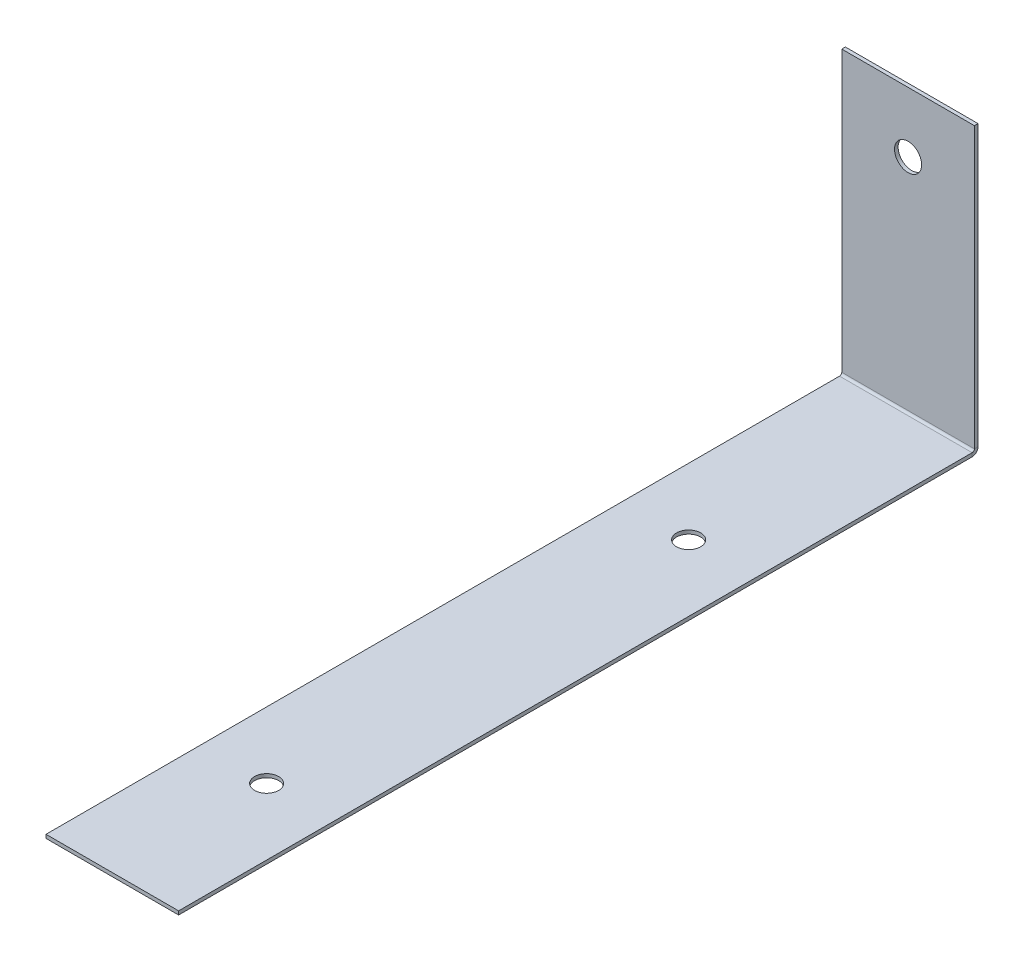
from build123d import *

# Parameters (mm, degrees)
SKETCH1_W              = 44
SKETCH1_H              = 360
BASE_FLANGE1_DEPTH     = 1.2
SKETCHED_START         = -22
SKETCHED_BEND1_DEPTH   = 44
SKETCHED_BEND1_2_DEPTH = 44
SKETCH7_R              = 4.5
CUT_EXTRUDE1_DEPTH     = 10
SKETCH8_R              = 4
CUT_EXTRUDE2_DEPTH     = 10


# Read off the part's stored shape, not the designer's step: Sketched Bend1
# Sheet-metal steps are written as plain solids
with BuildPart() as part:
    # Sketch1 → Base-Flange1 (new body)
    with BuildSketch(Plane(origin=(0, 0, 0), x_dir=(1, 0, 0), z_dir=(0, 1, 0))):
        Rectangle(SKETCH1_W, SKETCH1_H)
    extrude(amount=-BASE_FLANGE1_DEPTH)

    # Sketched Bend1 outline → Sketched Bend1 (cut)
    with BuildSketch(Plane.YZ.offset(SKETCHED_START)):
        with BuildLine():
            Line((0, -180), (0, -85.054444388))
            ThreePointArc((0, -85.054444388), (-0.872269031, -84.341342484), (-1.2, -83.2634))
            Line((-1.2, -83.2634), (-1.2, -180))
            Line((-1.2, -180), (0, -180))
        make_face()
    extrude(amount=SKETCHED_BEND1_DEPTH, mode=Mode.SUBTRACT)

    # Sketched Bend1 2 outline → Sketched Bend1 2 (add)
    with BuildSketch(Plane.YZ.offset(SKETCHED_START)):
        with BuildLine():
            Line((93.6, -84), (0.7366, -84))
            ThreePointArc((0.7366, -84), (0.215745145, -83.784254855), (0, -83.2634))
            Line((0, -83.2634), (0, -85.054444388))
            ThreePointArc((0, -85.054444388), (0.361178238, -85.163262642), (0.7366, -85.2))
            Line((0.7366, -85.2), (93.6, -85.2))
            Line((93.6, -85.2), (93.6, -84))
        make_face()
    extrude(amount=SKETCHED_BEND1_2_DEPTH)

    # Sketch7 → Cut-Extrude1 (cut)
    with BuildSketch(Plane(origin=(0, 0, -85.2), x_dir=(-1, 0, 0), z_dir=(0, 0, -1))):
        with Locations(Location((0, 73.6, 0), (0, 0, 90))):
            Circle(SKETCH7_R)
    extrude(amount=-CUT_EXTRUDE1_DEPTH, mode=Mode.SUBTRACT)

    # Sketch8 → Cut-Extrude2 (cut)
    with BuildSketch(Plane.XZ.offset(1.2)):
        with Locations(Location((0, -11.2, 0), (0, 0, 270))):
            Circle(SKETCH8_R)
        with Locations(Location((0, 128.8, 0), (0, 0, 270))):
            Circle(SKETCH8_R)
    extrude(amount=-CUT_EXTRUDE2_DEPTH, mode=Mode.SUBTRACT)


solid = part.part
